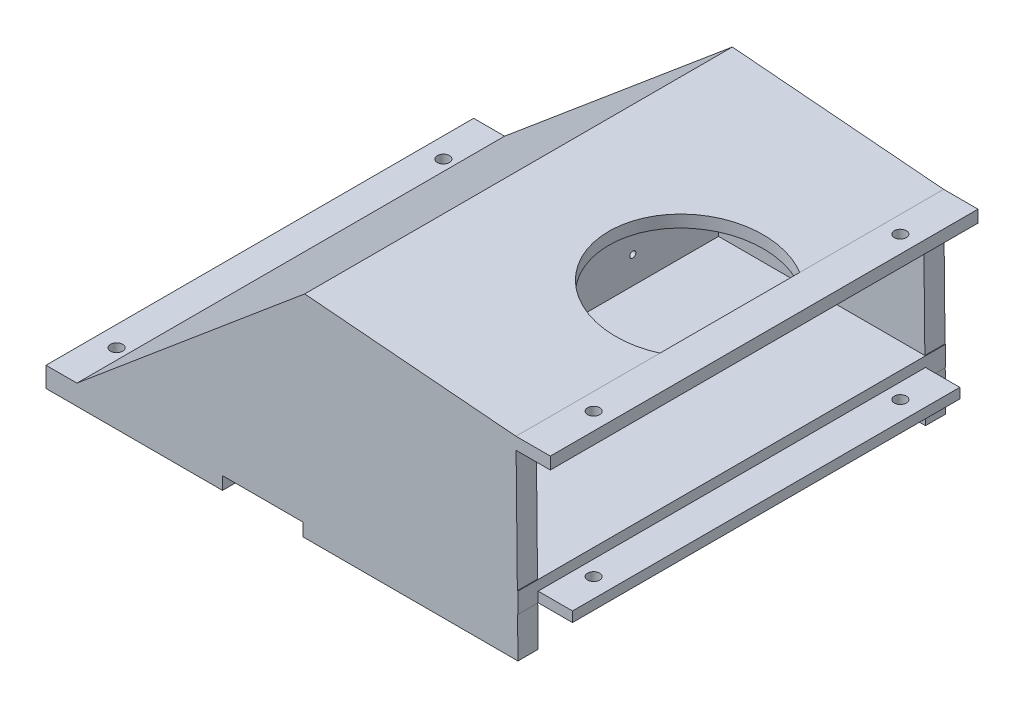
from build123d import *

# Parameters (mm, degrees)
BOSS_EXTRUDE1_DEPTH     = 212
CUT_EXTRUDE1_REACH      = 340.559
SKETCH2_W               = 17.02
SKETCH2_H               = 10
SKETCH3_R               = 1.5
CUT_EXTRUDE2_DEPTH      = 15
SKETCH4_R               = 3
CUT_EXTRUDE3_DEPTH      = 15
SKETCH5_W               = 30
SKETCH5_H               = 15
CUT_EXTRUDE4_DEPTH      = 15
CUT_EXTRUDE5_DEPTH      = 342.555266392
CUT_EXTRUDE5_DEPTH_BACK = 342.555266392
SKETCH6_R               = 3
BOSS_EXTRUDE2_DEPTH     = 10
BOSS_EXTRUDE3_DEPTH     = 10
CUT_EXTRUDE6_DEPTH      = 342.555266392
CUT_EXTRUDE6_DEPTH_BACK = 342.555266392
SKETCH9_W               = 40
SKETCH9_H               = 6.35
CUT_EXTRUDE9_DEPTH      = 25
CUT_EXTRUDE9_DEPTH_BACK = 27


with BuildPart() as part:
    # Sketch1 → Boss-Extrude1 (new body)
    with BuildSketch(Plane.XY):
        Polygon((0, 0), (0, -6), (-17.02, -6), (-118.621865464, 2.463033027), (-118.621865464, -66), (-16.042509221, -66), (-16.042509221, -71), (0.977490779, -71), (0.977490779, -76), (-206.164928148, -76), (-230, -96), (-250, -96), (-250, -86), (-234.663076582, -86), (-121.773554608, 8.725556251), (-17.02, 0), align=None)
        Polygon((-138.621865464, -19.324641013), (-138.621865464, -66), (-194.247392222, -66), align=None, mode=Mode.SUBTRACT)
    extrude(amount=BOSS_EXTRUDE1_DEPTH)

    # Sketch2 → Cut-Extrude1 (cut, up to next)
    with BuildSketch(Plane.XZ.offset(76), mode=Mode.PRIVATE) as cut_extrude1_sk1:
        with Locations((-7.532509221, 207)):
            Rectangle(SKETCH2_W, SKETCH2_H)
    cut_extrude1_tool1 = extrude(cut_extrude1_sk1.sketch, amount=-CUT_EXTRUDE1_REACH, mode=Mode.PRIVATE) & part.part
    # Sketch2 → Cut-Extrude1 (cut, up to next)
    with BuildSketch(Plane.XZ.offset(76), mode=Mode.PRIVATE) as cut_extrude1_sk2:
        with Locations((-7.532509221, 5)):
            Rectangle(SKETCH2_W, SKETCH2_H)
    cut_extrude1_tool2 = extrude(cut_extrude1_sk2.sketch, amount=-CUT_EXTRUDE1_REACH, mode=Mode.PRIVATE) & part.part
    add(cut_extrude1_tool1.solids().sort_by_distance((-7.532509, -76, 207))[0], mode=Mode.SUBTRACT)
    add(cut_extrude1_tool2.solids().sort_by_distance((-7.532509, -76, 5))[0], mode=Mode.SUBTRACT)

    # Sketch3 → Cut-Extrude2 (cut)
    with BuildSketch(Plane(origin=(-118.621865464, 0, 0), x_dir=(0, 0, -1), z_dir=(1, 0, 0))):
        with Locations((-159.5, -12.536966973)):
            Circle(SKETCH3_R)
        with Locations((-159.5, -52.536966973)):
            Circle(SKETCH3_R)
        with Locations((-52.5, -52.536966973)):
            Circle(SKETCH3_R)
        with Locations((-52.5, -12.536966973)):
            Circle(SKETCH3_R)
    extrude(amount=-CUT_EXTRUDE2_DEPTH, mode=Mode.SUBTRACT)

    # Sketch4 → Cut-Extrude3 (cut)
    with BuildSketch(Plane(origin=(0, -86, 0), x_dir=(1, 0, 0), z_dir=(0, 1, 0))):
        with Locations((-240, -25)):
            Circle(SKETCH4_R)
        with Locations((-240, -187)):
            Circle(SKETCH4_R)
    extrude(amount=-CUT_EXTRUDE3_DEPTH, mode=Mode.SUBTRACT)

    # Sketch5 → Cut-Extrude4 (cut)
    with BuildSketch(Plane(origin=(0, -66, 0), x_dir=(1, 0, 0), z_dir=(0, 1, 0))):
        with Locations((-98.621865464, -184.31184426)):
            Rectangle(SKETCH5_W, SKETCH5_H)
    extrude(amount=-CUT_EXTRUDE4_DEPTH, mode=Mode.SUBTRACT)

    # Sketch6 → Cut-Extrude5 (cut, two sides: drawn at the far end of the back side and taken through both)
    with BuildSketch(Plane(origin=(0, 0, 0), x_dir=(1, 0, 0), z_dir=(0, 1, 0)).offset(-CUT_EXTRUDE5_DEPTH_BACK)):
        with Locations((-8.52, -30)):
            Circle(SKETCH6_R)
        with Locations((-8.52, -182)):
            Circle(SKETCH6_R)
    extrude(amount=CUT_EXTRUDE5_DEPTH + CUT_EXTRUDE5_DEPTH_BACK, mode=Mode.SUBTRACT)

    # Sketch7 → Boss-Extrude2 (add)
    with BuildSketch(Plane.XY.offset(212)):
        Polygon((-17.02, 0), (-121.773554608, 8.725556251), (-234.663076582, -86), (-250, -86), (-250, -96), (-16.042509221, -96), align=None)
    extrude(amount=-BOSS_EXTRUDE2_DEPTH)

    # Sketch8 → Boss-Extrude3 (add)
    with BuildSketch(Plane(origin=(0, 0, 0), x_dir=(-1, 0, 0), z_dir=(0, 0, -1))):
        Polygon((250, -96), (230, -96), (16.042509221, -96), (17.02, 0), (121.773554608, 8.725556251), (234.663076582, -86), (250, -86), align=None)
    extrude(amount=-BOSS_EXTRUDE3_DEPTH)

    # Sketch9 → Cut-Extrude6 (cut, two sides: drawn at the far end of the back side and taken through both)
    with BuildSketch(Plane.XY.offset(212).offset(-CUT_EXTRUDE6_DEPTH_BACK)):
        with Locations((-142.5, -92.825)):
            Rectangle(SKETCH9_W, SKETCH9_H)
    extrude(amount=CUT_EXTRUDE6_DEPTH + CUT_EXTRUDE6_DEPTH_BACK, mode=Mode.SUBTRACT)

    # Sketch10 → Cut-Extrude9 (cut, two sides: drawn at the far end of the back side and taken through both)
    with BuildSketch(Plane(origin=(0, 0, 0), x_dir=(1, 0, 0), z_dir=(0, 1, 0)).offset(-CUT_EXTRUDE9_DEPTH_BACK)):
        with BuildLine():
            Line((-17.02, -140.638963654), (-17.02, -71.361036346))
            ThreePointArc((-17.02, -71.361036346), (-77.023554608, -106), (-17.02, -140.638963654))
        make_face()
    extrude(amount=CUT_EXTRUDE9_DEPTH + CUT_EXTRUDE9_DEPTH_BACK, mode=Mode.SUBTRACT)


solid = part.part
